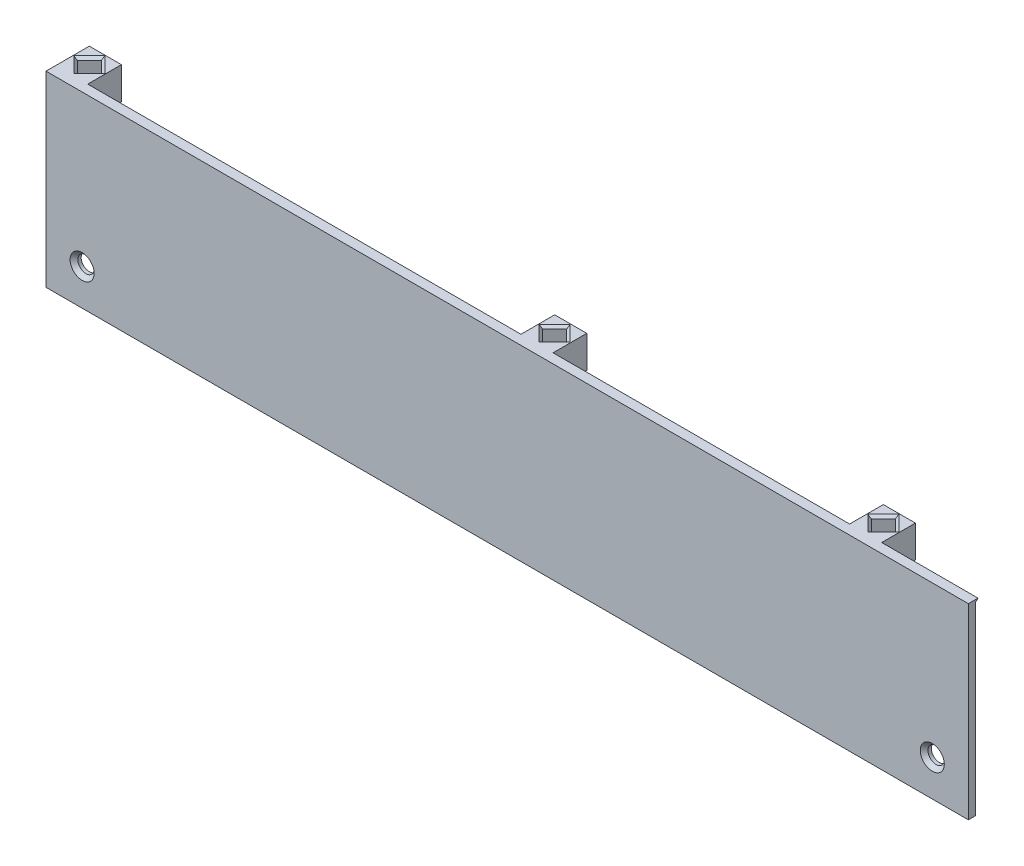
from build123d import *

# Parameters (mm, degrees)
SKETCH1_W                       = 243.332
SKETCH1_H                       = 49.394999
BOSS_EXTRUDE1_DEPTH             = 1.905
SKETCH2_W                       = 8.466666667
SKETCH2_H                       = 8.466666667
SKETCH2_W_2                     = 8.466666666
BOSS_EXTRUDE2_DEPTH             = 9.525
CUT_EXTRUDE1_DEPTH              = 6.35
CHAMFER1_SIZE                   = 0.635
BOSS_EXTRUDE3_START             = -234.865333
BOSS_EXTRUDE3_DEPTH             = 234.865333
F_6_CLEARANCE_HOLE1_D           = 4.3053
F_6_CLEARANCE_HOLE1_CSINK_D     = 6.35
F_6_CLEARANCE_HOLE1_CSINK_ANGLE = 90


with BuildPart() as part:
    # Sketch1 → Boss-Extrude1 (new body)
    with BuildSketch(Plane.XY):
        with Locations((121.666, 24.6974995)):
            Rectangle(SKETCH1_W, SKETCH1_H)
    extrude(amount=BOSS_EXTRUDE1_DEPTH)

    # Sketch2 → Boss-Extrude2 (add)
    with BuildSketch(Plane.XY):
        with Locations((4.233333334, 45.161665666)):
            Rectangle(SKETCH2_W, SKETCH2_H)
        with Locations((127, 45.161665666)):
            Rectangle(SKETCH2_W_2, SKETCH2_H)
        with Locations((213.698666667, 45.161665666)):
            Rectangle(SKETCH2_W, SKETCH2_H)
    extrude(amount=-BOSS_EXTRUDE2_DEPTH)

    # Sketch3 → Cut-Extrude1 (cut)
    with BuildSketch(Plane(origin=(0, 49.394999, 0), x_dir=(1, 0, 0), z_dir=(0, 1, 0))):
        Polygon((1.058333333, 5.291666667), (4.233333333, 8.466666667), (7.408333333, 5.291666667), (4.233333333, 2.116666667), align=None)
        Polygon((123.825, 5.291666667), (127, 8.466666667), (130.175, 5.291666667), (127, 2.116666667), align=None)
        Polygon((210.523666667, 5.291666667), (213.698666667, 8.466666667), (216.873666667, 5.291666667), (213.698666667, 2.116666667), align=None)
    extrude(amount=-CUT_EXTRUDE1_DEPTH, mode=Mode.SUBTRACT)

    # Chamfer1
    chamfer1_edges = [part.edges().sort_by_distance(p)[0] for p in [
        (2.645833333, 43.044999, -3.704166667),
        (2.645833333, 43.044999, -6.879166667),
        (5.820833333, 43.044999, -6.879166667),
        (5.820833333, 43.044999, -3.704166667),
        (2.645833333, 49.394999, -3.704166667),
        (5.820833333, 49.394999, -3.704166667),
        (5.820833333, 49.394999, -6.879166667),
        (2.645833333, 49.394999, -6.879166667),
        (125.4125, 43.044999, -3.704166667),
        (125.4125, 43.044999, -6.879166667),
        (128.5875, 43.044999, -6.879166667),
        (128.5875, 43.044999, -3.704166667),
        (125.4125, 49.394999, -3.704166667),
        (128.5875, 49.394999, -3.704166667),
        (128.5875, 49.394999, -6.879166667),
        (125.4125, 49.394999, -6.879166667),
        (212.111166667, 43.044999, -3.704166667),
        (212.111166667, 43.044999, -6.879166667),
        (215.286166667, 43.044999, -6.879166667),
        (215.286166667, 43.044999, -3.704166667),
        (212.111166667, 49.394999, -3.704166667),
        (215.286166667, 49.394999, -3.704166667),
        (215.286166667, 49.394999, -6.879166667),
        (212.111166667, 49.394999, -6.879166667),
    ]]
    chamfer(chamfer1_edges, length=CHAMFER1_SIZE)


with BuildPart() as boss_extrude3_tool:
    # Sketch4 → Boss-Extrude3 (new body)
    with BuildSketch(Plane(origin=(243.332, 0, 0), x_dir=(0, 0, -1), z_dir=(1, 0, 0)).offset(BOSS_EXTRUDE3_START)):
        Polygon((0, 49.394999), (0.635, 49.394999), (0, 48.759999), align=None)
    extrude(amount=BOSS_EXTRUDE3_DEPTH)


with BuildPart() as part_1:
    add(part.part)


with BuildPart() as part_2:
    # Boss-Extrude3: joined with boss_extrude3_tool
    add(part_1.part.fuse(boss_extrude3_tool.part, tol=0.00001))

    # #6 Clearance Hole1 (through all)
    with Locations(Plane.XY.offset(1.905)):
        with Locations((9.525, 9.525), (233.807, 9.525)):
            CounterSinkHole(F_6_CLEARANCE_HOLE1_D / 2, F_6_CLEARANCE_HOLE1_CSINK_D / 2, counter_sink_angle=F_6_CLEARANCE_HOLE1_CSINK_ANGLE)


solid = part_2.part
